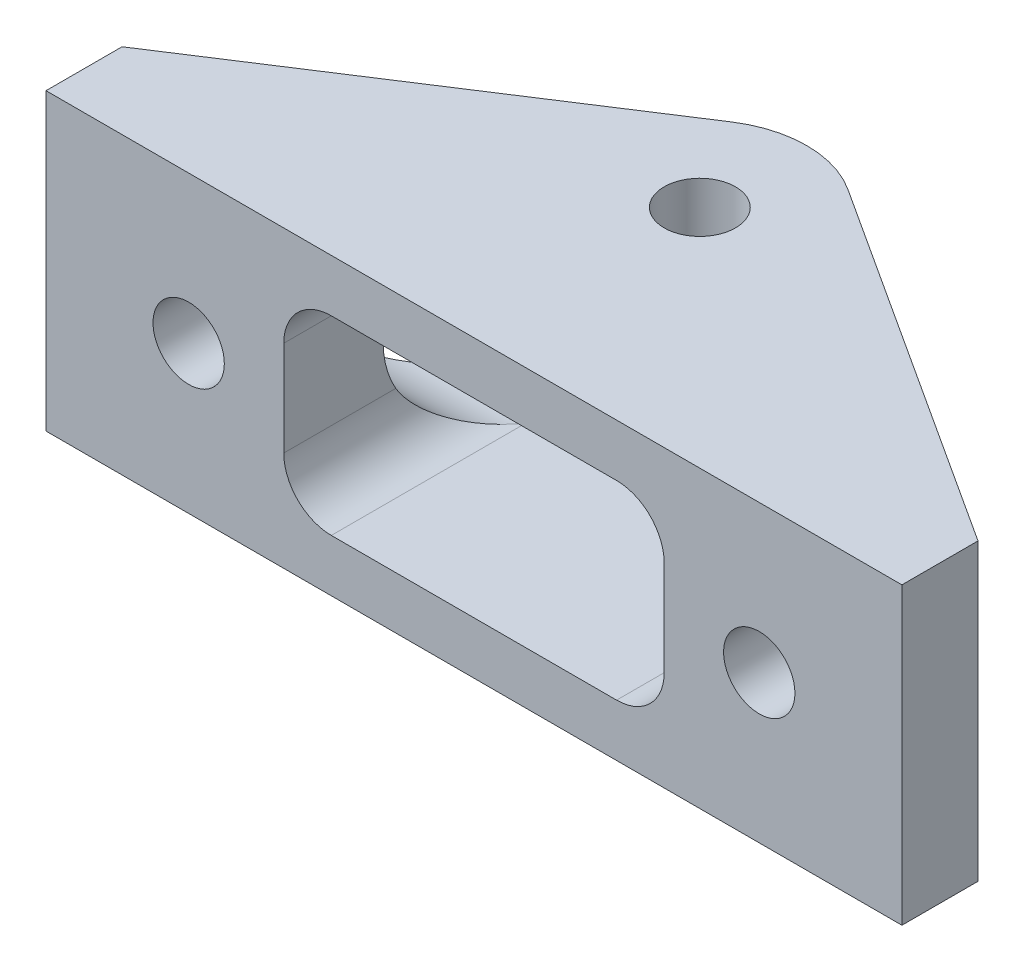
from build123d import *

# Parameters (mm, degrees)
SKETCH1_R              = 2.38125
BOSS_EXTRUDE1_DEPTH    = 19.685
SKETCH2_W              = 15.5956
SKETCH2_H              = 12.7
CUT_EXTRUDE1_DEPTH     = 65.401648659
FILLET1_R              = 6.35
SKETCH3_R              = 2.38125
SKETCH3_W              = 25.4
SKETCH3_H              = 12.7
CUT_EXTRUDE2_DEPTH     = 65.40164869
FILLET2_R              = 3.175
CUT_EXTRUDE5_OUTLINE_R = 4.7625
CUT_EXTRUDE5_DEPTH     = 2.149867926


with BuildPart() as part:
    # Sketch1 → Boss-Extrude1 (new body)
    with BuildSketch(Plane(origin=(0, 0, 0), x_dir=(1, 0, 0), z_dir=(0, 1, 0))):
        with BuildLine():
            Line((0, 5.08), (24.690664344, 21.076673302))
            ThreePointArc((24.690664344, 21.076673302), (28.575, 22.225), (32.459335656, 21.076673302))
            Line((32.459335656, 21.076673302), (57.15, 5.08))
            Line((57.15, 5.08), (57.15, 0))
            Line((57.15, 0), (0, 0))
            Line((0, 0), (0, 5.08))
        make_face()
        with Locations(Location((28.575, 15.08125, 0), (0, 0, 270))):
            Circle(SKETCH1_R, mode=Mode.SUBTRACT)
    extrude(amount=-BOSS_EXTRUDE1_DEPTH)

    # Sketch2 → Cut-Extrude1 (cut, through all)
    with BuildSketch(Plane(origin=(57.15, 0, 0), x_dir=(0, 0, -1), z_dir=(1, 0, 0))):
        with Locations((14.4272, -9.8425)):
            Rectangle(SKETCH2_W, SKETCH2_H)
    extrude(amount=-CUT_EXTRUDE1_DEPTH, mode=Mode.SUBTRACT)

    # Fillet1
    fillet1_edges = [part.edges().sort_by_distance(p)[0] for p in [
        (28.575, -16.1925, -6.6294),
        (28.575, -3.4925, -6.6294),
    ]]
    fillet(fillet1_edges, radius=FILLET1_R - 0.0001)  # a hair under: the kernel refuses the full size

    # Sketch3 → Cut-Extrude2 (cut, through all)
    with BuildSketch(Plane.XY):
        with Locations((9.525, -9.8425)):
            Circle(SKETCH3_R)
        with Locations((47.625, -9.8425)):
            Circle(SKETCH3_R)
        with Locations((28.575, -9.8425)):
            Rectangle(SKETCH3_W, SKETCH3_H)
    extrude(amount=-CUT_EXTRUDE2_DEPTH, mode=Mode.SUBTRACT)

    # Fillet2
    fillet2_edges = [part.edges().sort_by_distance(p)[0] for p in [
        (41.275, -3.4925, -6.48965),
        (15.875, -16.1925, -6.48965),
        (41.275, -16.1925, -6.48965),
        (15.875, -3.4925, -6.48965),
    ]]
    fillet(fillet2_edges, radius=FILLET2_R)

    # Cut-Extrude5: read off the stored shape, not the designer's step
    # Cut-Extrude5 outline → Cut-Extrude5 (cut)
    with BuildSketch(Plane(origin=(0, 0, -6.6294), x_dir=(-1, 0, 0), z_dir=(0, 0, -1))):
        with Locations((-47.625, -9.8425)):
            Circle(CUT_EXTRUDE5_OUTLINE_R)
        with Locations((-9.525, -9.8425)):
            Circle(CUT_EXTRUDE5_OUTLINE_R)
    extrude(amount=CUT_EXTRUDE5_DEPTH, mode=Mode.SUBTRACT)


solid = part.part
